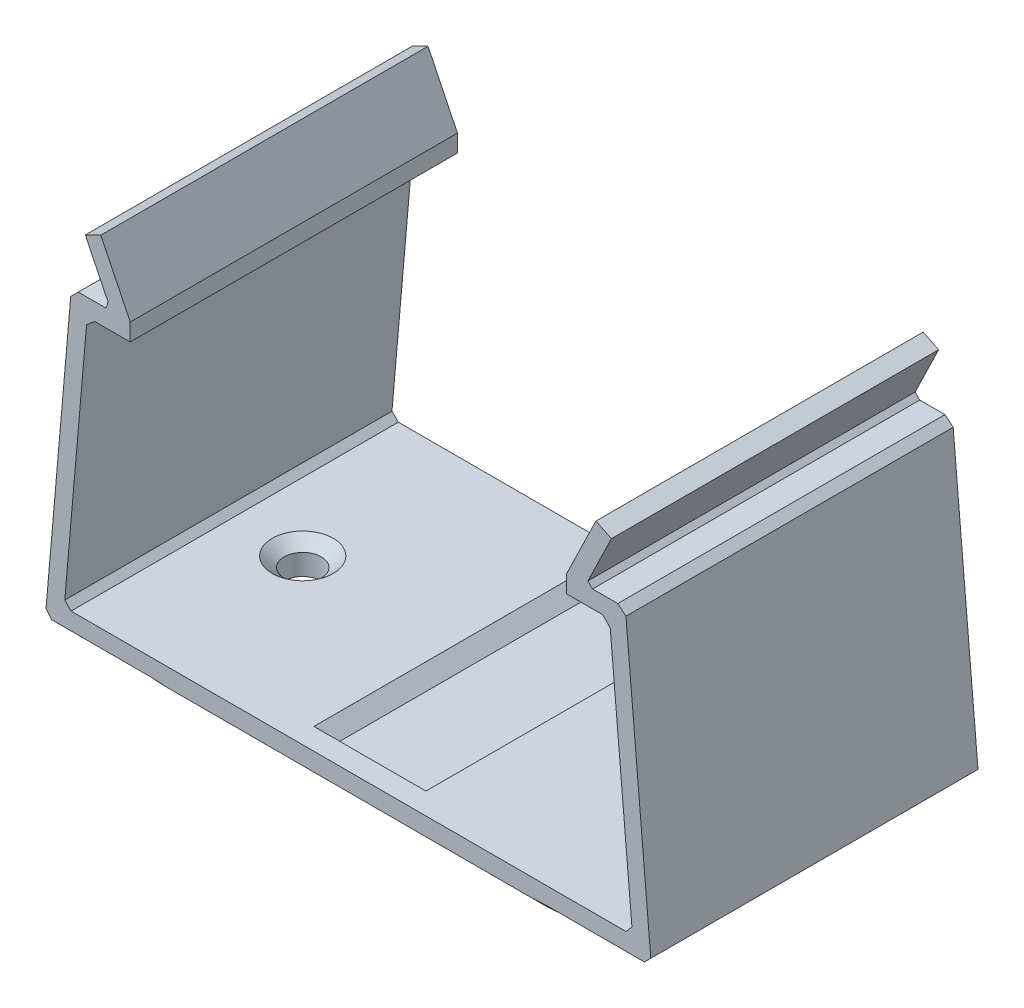
from build123d import *
from OCP.BRepFilletAPI import BRepFilletAPI_MakeChamfer

# Parameters (mm, degrees)
BOSS_EXTRUDE1_DEPTH                               = 38
SKETCH5_W                                         = 63
SKETCH5_H                                         = 38
BOSS_EXTRUDE2_DEPTH                               = 1.6
SKETCH9_W                                         = 10
SKETCH9_H                                         = 30
CUT_EXTRUDE4_DEPTH                                = 1.5
CHAMFER4_SIZE                                     = 1.5
CHAMFER6_SIZE                                     = 0.8
CHAMFER6_SIZE2                                    = 0.738449877
CHAMFER7_SIZE                                     = 0.8
CHAMFER7_SIZE2                                    = 0.880050294
CHAMFER7_SIZE2_2                                  = 0.59857957
CSK_FOR_6_FLAT_HEAD_MACHINE_SCREW_100_D           = 4.3053
CSK_FOR_6_FLAT_HEAD_MACHINE_SCREW_100_DEPTH       = 3.6
CSK_FOR_6_FLAT_HEAD_MACHINE_SCREW_100_CSINK_D     = 7.0866
CSK_FOR_6_FLAT_HEAD_MACHINE_SCREW_100_CSINK_ANGLE = 100
FILLET1_R                                         = 10
CHAMFER10_SIZE                                    = 1.5


with BuildPart() as part:
    # Sketch1 → Boss-Extrude1 (new body)
    with BuildSketch(Plane.XY):
        Polygon((-32.16425811, 32.5), (-27.555232111, 32.5), (-30.546782223, 38.65618727), (-28.747926936, 39.530326652), (-25.331595762, 32.5), (-25.331595762, 30.5), (-30.331595762, 30.5), (-33, 0), (0, 0), (33, 0), (30.331595762, 30.5), (25.331595762, 30.5), (25.331595762, 32.5), (28.747926936, 39.530326652), (30.546782223, 38.65618727), (27.555232111, 32.5), (32.16425811, 32.5), (35.182617002, -2), (0, -2), (-35.182617002, -2), align=None)
    extrude(amount=BOSS_EXTRUDE1_DEPTH)

    # Sketch5 → Boss-Extrude2 (add)
    with BuildSketch(Plane.XZ.offset(2)):
        with Locations((0, 19)):
            Rectangle(SKETCH5_W, SKETCH5_H)
    extrude(amount=BOSS_EXTRUDE2_DEPTH)

    # Sketch9 → Cut-Extrude4 (cut)
    with BuildSketch(Plane(origin=(0, 0, 0), x_dir=(1, 0, 0), z_dir=(0, 1, 0))):
        with Locations((0, -19)):
            Rectangle(SKETCH9_W, SKETCH9_H)
    extrude(amount=-CUT_EXTRUDE4_DEPTH, mode=Mode.SUBTRACT)

    # Chamfer4
    chamfer4_edges = [part.edges().sort_by_distance(p)[0] for p in [
        (0, 0, 34),
        (-5, 0, 19),
        (0, 0, 4),
        (5, 0, 19),
    ]]
    chamfer(chamfer4_edges, length=CHAMFER4_SIZE - 0.0001)  # a hair under: the kernel refuses the full size

    # Chamfer6: one chamfer whose edges measure the first distance from different faces: ONE call of the kernel's chamfer builder (chamfer() names one face for all edges)
    chamfer6_edges_1 = [part.edges().sort_by_distance(p)[0] for p in [
        (-33, 0, 19),
    ]]
    chamfer6_side_1 = [part.faces().sort_by_distance(p)[0] for p in [
        (0, 0, 36.261477311),
    ]]
    chamfer6_edges_2 = [part.edges().sort_by_distance(p)[0] for p in [
        (33, 0, 19),
    ]]
    chamfer6_side_2 = [part.faces().sort_by_distance(p)[0] for p in [
        (31.665797881, 15.25, 19),
    ]]
    chamfer6_edges_3 = [part.edges().sort_by_distance(p)[0] for p in [
        (35.182617002, -2, 19),
    ]]
    chamfer6_side_3 = [part.faces().sort_by_distance(p)[0] for p in [
        (33.341308501, -2, 19),
    ]]
    chamfer6_edges_4 = [part.edges().sort_by_distance(p)[0] for p in [
        (-35.182617002, -2, 19),
    ]]
    chamfer6_side_4 = [part.faces().sort_by_distance(p)[0] for p in [
        (-33.673437556, 15.25, 19),
    ]]
    chamfer6 = BRepFilletAPI_MakeChamfer(part.part.solid().wrapped)
    for e in chamfer6_edges_1:
        chamfer6.Add(CHAMFER6_SIZE, CHAMFER6_SIZE2, e.wrapped, chamfer6_side_1[0].wrapped)  # the first distance lies on this face
    for e in chamfer6_edges_2:
        chamfer6.Add(CHAMFER6_SIZE, CHAMFER6_SIZE2, e.wrapped, chamfer6_side_2[0].wrapped)  # the first distance lies on this face
    for e in chamfer6_edges_3:
        chamfer6.Add(CHAMFER6_SIZE, CHAMFER6_SIZE2, e.wrapped, chamfer6_side_3[0].wrapped)  # the first distance lies on this face
    for e in chamfer6_edges_4:
        chamfer6.Add(CHAMFER6_SIZE, CHAMFER6_SIZE2, e.wrapped, chamfer6_side_4[0].wrapped)  # the first distance lies on this face
    add(Compound.cast(chamfer6.Shape()), mode=Mode.REPLACE)

    # Chamfer7: one chamfer whose edges measure the first distance from different faces: ONE call of the kernel's chamfer builder (chamfer() names one face for all edges)
    chamfer7_edges_1 = [part.edges().sort_by_distance(p)[0] for p in [
        (-30.331595762, 30.5, 19),
    ]]
    chamfer7_side_1 = [part.faces().sort_by_distance(p)[0] for p in [
        (-31.633617807, 15.617819926, 19),
    ]]
    chamfer7_edges_2 = [part.edges().sort_by_distance(p)[0] for p in [
        (30.331595762, 30.5, 19),
    ]]
    chamfer7_side_2 = [part.faces().sort_by_distance(p)[0] for p in [
        (27.831595762, 30.5, 19),
    ]]
    chamfer7_edges_3 = [part.edges().sort_by_distance(p)[0] for p in [
        (27.555232111, 32.5, 19),
    ]]
    chamfer7_side_3 = [part.faces().sort_by_distance(p)[0] for p in [
        (29.859745111, 32.5, 19),
    ]]
    chamfer7_edges_4 = [part.edges().sort_by_distance(p)[0] for p in [
        (32.16425811, 32.5, 19),
    ]]
    chamfer7_side_4 = [part.faces().sort_by_distance(p)[0] for p in [
        (33.641257483, 15.617819926, 19),
    ]]
    chamfer7_edges_5 = [part.edges().sort_by_distance(p)[0] for p in [
        (-32.16425811, 32.5, 19),
    ]]
    chamfer7_side_5 = [part.faces().sort_by_distance(p)[0] for p in [
        (-29.859745111, 32.5, 19),
    ]]
    chamfer7_edges_6 = [part.edges().sort_by_distance(p)[0] for p in [
        (-27.555232111, 32.5, 19),
    ]]
    chamfer7_side_6 = [part.faces().sort_by_distance(p)[0] for p in [
        (-29.051007167, 35.578093635, 19),
    ]]
    chamfer7 = BRepFilletAPI_MakeChamfer(part.part.solid().wrapped)
    for e in chamfer7_edges_1:
        chamfer7.Add(CHAMFER7_SIZE, CHAMFER7_SIZE2, e.wrapped, chamfer7_side_1[0].wrapped)  # the first distance lies on this face
    for e in chamfer7_edges_2:
        chamfer7.Add(CHAMFER7_SIZE, CHAMFER7_SIZE2, e.wrapped, chamfer7_side_2[0].wrapped)  # the first distance lies on this face
    for e in chamfer7_edges_3:
        chamfer7.Add(CHAMFER7_SIZE, CHAMFER7_SIZE2_2, e.wrapped, chamfer7_side_3[0].wrapped)  # the first distance lies on this face
    for e in chamfer7_edges_4:
        chamfer7.Add(CHAMFER7_SIZE, CHAMFER7_SIZE2, e.wrapped, chamfer7_side_4[0].wrapped)  # the first distance lies on this face
    for e in chamfer7_edges_5:
        chamfer7.Add(CHAMFER7_SIZE, CHAMFER7_SIZE2, e.wrapped, chamfer7_side_5[0].wrapped)  # the first distance lies on this face
    for e in chamfer7_edges_6:
        chamfer7.Add(CHAMFER7_SIZE, CHAMFER7_SIZE2_2, e.wrapped, chamfer7_side_6[0].wrapped)  # the first distance lies on this face
    add(Compound.cast(chamfer7.Shape()), mode=Mode.REPLACE)

    # CSK for #6 Flat Head Machine Screw (100)1
    with Locations(Plane(origin=(0, 0, 0), x_dir=(1, 0, 0), z_dir=(0, 1, 0))):
        with Locations((24.3, -19), (-24.3, -19)):
            CounterSinkHole(CSK_FOR_6_FLAT_HEAD_MACHINE_SCREW_100_D / 2, CSK_FOR_6_FLAT_HEAD_MACHINE_SCREW_100_CSINK_D / 2, depth=CSK_FOR_6_FLAT_HEAD_MACHINE_SCREW_100_DEPTH, counter_sink_angle=CSK_FOR_6_FLAT_HEAD_MACHINE_SCREW_100_CSINK_ANGLE)

    # Fillet1
    fillet1_edges = [part.edges().sort_by_distance(p)[0] for p in [
        (-31.5, -2.8, 0),
        (31.5, -2.8, 0),
        (31.5, -2.8, 38),
        (-31.5, -2.8, 38),
    ]]
    fillet(fillet1_edges, radius=FILLET1_R)

    # Chamfer10
    chamfer10_edges = [part.edges().sort_by_distance(p)[0] for p in [
        (-31.5, -3.6, 19),
        (0, -3.6, 38),
        (0, -3.6, 0),
        (31.5, -3.6, 19),
        (28.571067812, -3.6, 35.071067812),
        (28.571067812, -3.6, 2.928932188),
        (-28.571067812, -3.6, 2.928932188),
        (-28.571067812, -3.6, 35.071067812),
    ]]
    chamfer(chamfer10_edges, length=CHAMFER10_SIZE)


solid = part.part
